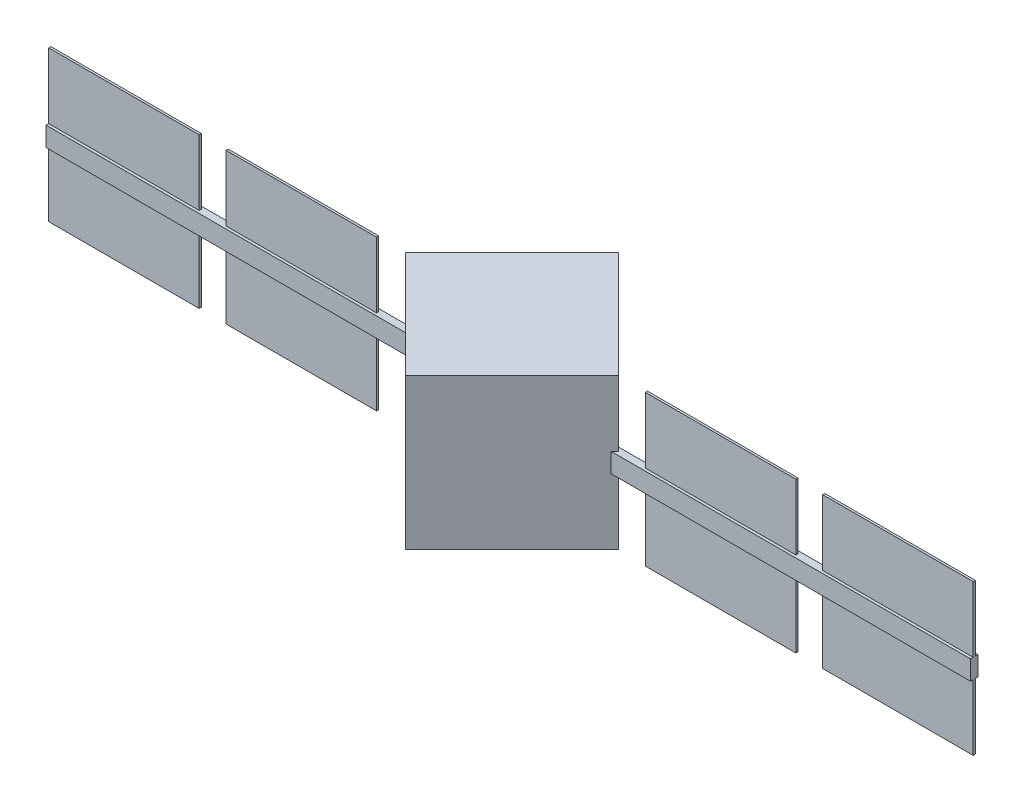
from build123d import *

# Parameters (mm, degrees)
SCHIZZO1_W                   = 700
SCHIZZO1_H                   = 700
ESTRUSIONE_ESTRUSIONE1_DEPTH = 350
SCHIZZO4_W                   = 90
SCHIZZO4_H                   = 35
ESTRUSIONE_ESTRUSIONE2_DEPTH = 2150
SCHIZZO6_W                   = 700
SCHIZZO6_H                   = 700
ESTRUSIONE_ESTRUSIONE3_DEPTH = 5
SCHIZZO7_W                   = 700
SCHIZZO7_H                   = 700
ESTRUSIONE_ESTRUSIONE4_DEPTH = 5
CORPO_SPOSTA_COPIA1_ANGLE    = 45


with BuildPart() as part:
    # Schizzo1 → Estrusione-Estrusione1 (new, symmetric)
    with BuildSketch(Plane(origin=(0, 0, 0), x_dir=(1, 0, 0), z_dir=(0, 1, 0))):
        Rectangle(SCHIZZO1_W, SCHIZZO1_H)
    extrude(amount=ESTRUSIONE_ESTRUSIONE1_DEPTH, both=True)

    # Schizzo4 → Estrusione-Estrusione2 (add, symmetric)
    with BuildSketch(Plane(origin=(0, 0, 0), x_dir=(0, -1, 0), z_dir=(-0.7071067811865488, 0, 0.7071067811865464))):
        Rectangle(SCHIZZO4_W, SCHIZZO4_H)
    extrude(amount=ESTRUSIONE_ESTRUSIONE2_DEPTH, both=True)

    # Schizzo6 → Estrusione-Estrusione3 (add, symmetric)
    with BuildSketch(Plane(origin=(0, 0, 0), x_dir=(0, -1, 0), z_dir=(0.7071067811865488, 0, 0.7071067811865464))):
        with Locations((0, -974.974746831)):
            Rectangle(SCHIZZO6_W, SCHIZZO6_H)
    estrusione_estrusione3 = extrude(amount=ESTRUSIONE_ESTRUSIONE3_DEPTH, both=True)

    # Schizzo7 → Estrusione-Estrusione4 (add, symmetric)
    with BuildSketch(Plane(origin=(0, 0, 0), x_dir=(0, -1, 0), z_dir=(0.7071067811865488, 0, 0.7071067811865464))):
        with Locations((0, -1800)):
            Rectangle(SCHIZZO7_W, SCHIZZO7_H)
    estrusione_estrusione4 = extrude(amount=ESTRUSIONE_ESTRUSIONE4_DEPTH, both=True)

    # Specchia1: Estrusione-Estrusione3, Estrusione-Estrusione4 across plane
    add(estrusione_estrusione3.mirror(Plane(origin=(0, 0, 0), x_dir=(0.7071067811865465, 0, 0.7071067811865486), z_dir=(-0.7071067811865488, 0, 0.7071067811865464))))
    add(estrusione_estrusione4.mirror(Plane(origin=(0, 0, 0), x_dir=(0.7071067811865465, 0, 0.7071067811865486), z_dir=(-0.7071067811865488, 0, 0.7071067811865464))))


with BuildPart() as part_1:
    # Corpo-Sposta/copia1: moved
    add(part.part.rotate(Axis((0, 0, 0), (0, -1, 0)), CORPO_SPOSTA_COPIA1_ANGLE))


solid = part_1.part
